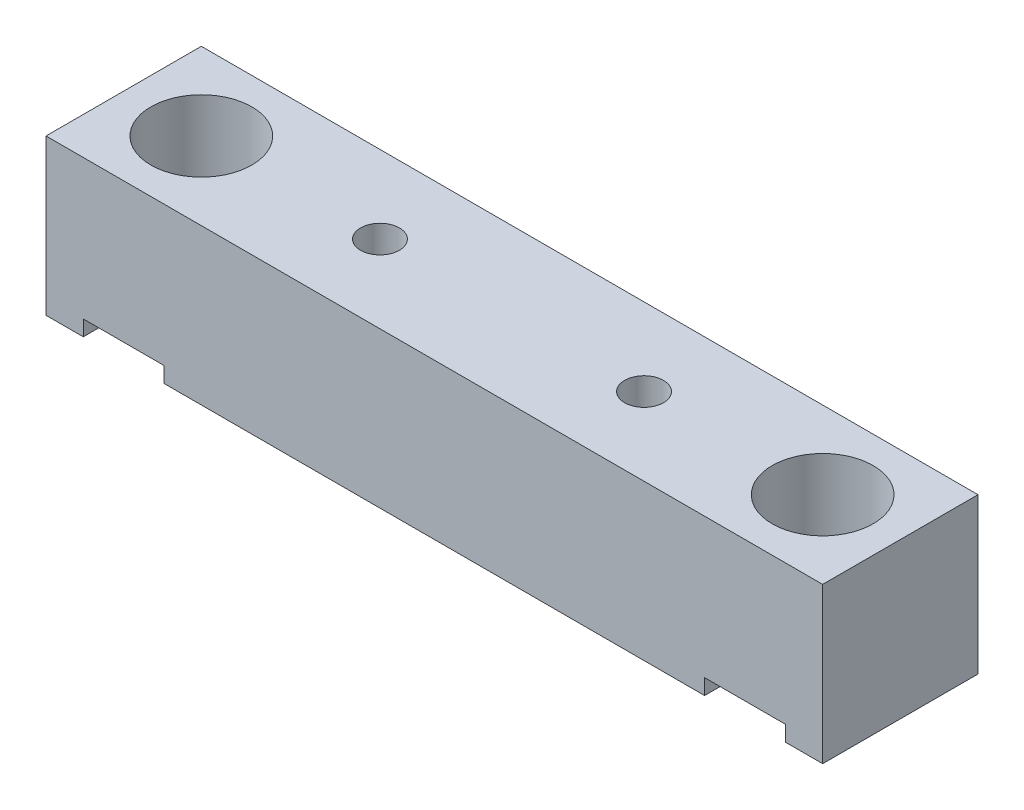
from build123d import *

# Parameters (mm, degrees)
SKETCH1_W                      = 50
SKETCH1_H                      = 10
BOSS_EXTRUDE1_DEPTH            = 10
SKETCH2_W                      = 5.2
SKETCH2_H                      = 1
CUT_EXTRUDE1_DEPTH             = 10
CBORE_FOR_M3_SHCS1_D           = 3.4
CBORE_FOR_M3_SHCS1_CBORE_D     = 6.5
CBORE_FOR_M3_SHCS1_CBORE_DEPTH = 6
M3X0_5_TAPPED_HOLE1_D          = 2.5
M3X0_5_TAPPED_HOLE1_DEPTH      = 7.5
M3X0_5_TAPPED_HOLE1_TIP        = 0.751075774


with BuildPart() as part:
    # Sketch1 → Boss-Extrude1 (new body)
    with BuildSketch(Plane(origin=(0, 0, 0), x_dir=(1, 0, 0), z_dir=(0, 1, 0))):
        Rectangle(SKETCH1_W, SKETCH1_H)
    extrude(amount=BOSS_EXTRUDE1_DEPTH)

    # Sketch2 → Cut-Extrude1 (cut)
    with BuildSketch(Plane.XY.offset(5)):
        with Locations((20, 0.5)):
            Rectangle(SKETCH2_W, SKETCH2_H)
    cut_extrude1 = extrude(amount=-CUT_EXTRUDE1_DEPTH, mode=Mode.SUBTRACT)

    # CBORE for M3 SHCS1 (through all)
    with Locations(Plane(origin=(0, 10, 0), x_dir=(1, 0, 0), z_dir=(0, 1, 0))):
        with Locations((20, 0)):
            cbore_for_m3_shcs1 = CounterBoreHole(CBORE_FOR_M3_SHCS1_D / 2, CBORE_FOR_M3_SHCS1_CBORE_D / 2, CBORE_FOR_M3_SHCS1_CBORE_DEPTH)

    # Mirror1: Cut-Extrude1, CBORE for M3 SHCS1 across plane
    add(cut_extrude1.mirror(Plane(origin=(0, 0, 0), x_dir=(0, 0, 1), z_dir=(1, 0, 0))), mode=Mode.SUBTRACT)
    add(cbore_for_m3_shcs1.mirror(Plane(origin=(0, 0, 0), x_dir=(0, 0, 1), z_dir=(1, 0, 0))), mode=Mode.SUBTRACT)

    # M3x0.5 Tapped Hole1
    with Locations(Plane(origin=(0, 10, 0), x_dir=(1, 0, 0), z_dir=(0, 1, 0))):
        with Locations((-8.5, 0), (8.5, 0)):
            Hole(M3X0_5_TAPPED_HOLE1_D / 2, depth=M3X0_5_TAPPED_HOLE1_DEPTH)
            with Locations((0, 0, -(M3X0_5_TAPPED_HOLE1_DEPTH + M3X0_5_TAPPED_HOLE1_TIP / 2))):  # 118° drill point
                Cone(0, M3X0_5_TAPPED_HOLE1_D / 2, M3X0_5_TAPPED_HOLE1_TIP, mode=Mode.SUBTRACT)


solid = part.part
